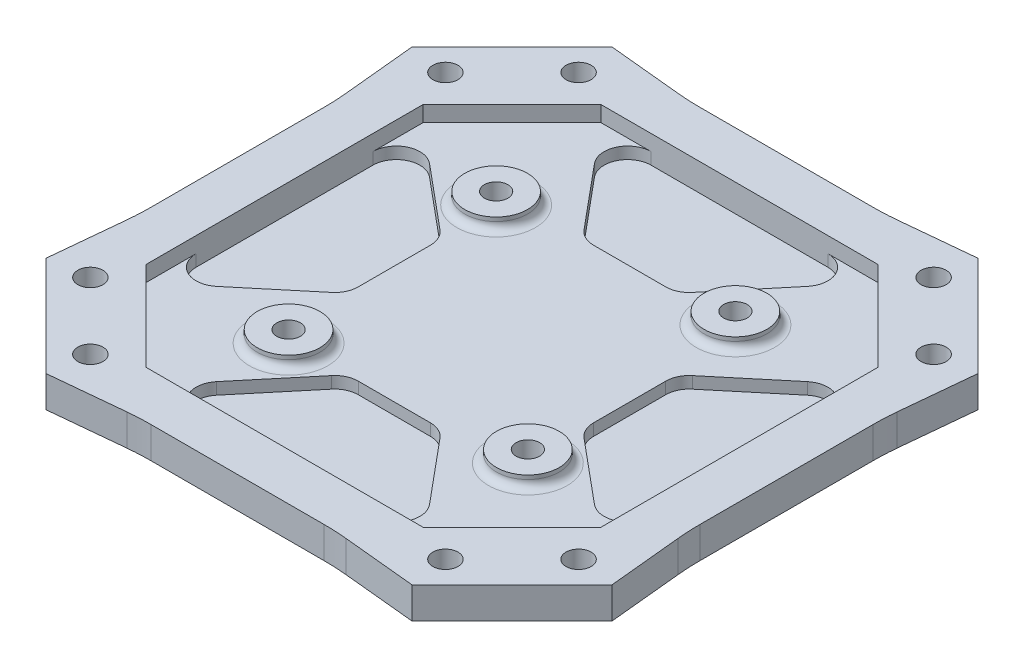
from build123d import *

# Parameters (mm, degrees)
SKETCH2_R           = 1.6
BOSS_EXTRUDE1_DEPTH = 4
CUT_EXTRUDE1_DEPTH  = 2
CUT_EXTRUDE2_DEPTH  = 1.5
SKETCH5_R           = 1.5
CUT_EXTRUDE3_DEPTH  = 52.039200621
BOSS_EXTRUDE2_START = 1.5
SKETCH6_R           = 4
SKETCH6_R_2         = 1.5
BOSS_EXTRUDE2_DEPTH = 1.5
CIRPATTERN1_COUNT   = 4
FILLET1_R           = 1
FILLET2_R           = 30


with BuildPart() as part:
    # Sketch2 → Boss-Extrude1 (new body)
    with BuildSketch(Plane(origin=(0, 0, 0), x_dir=(1, 0, 0), z_dir=(0, 1, 0))):
        Polygon((-12.5, 35), (12.5, 35), (23.334523779, 36.062445841), (36.062445841, 23.334523779), (35, 12.5), (35, -12.5), (36.062445841, -23.334523779), (23.334523779, -36.062445841), (12.5, -35), (-12.5, -35), (-23.334523779, -36.062445841), (-36.062445841, -23.334523779), (-35, -12.5), (-35, 12.5), (-36.062445841, 23.334523779), (-23.334523779, 36.062445841), align=None)
        with Locations(Location((22.627416998, 31.112698372, 0), (0, 0, 270))):
            Circle(SKETCH2_R, mode=Mode.SUBTRACT)
        with Locations(Location((31.112698372, 22.627416998, 0), (0, 0, 270))):
            Circle(SKETCH2_R, mode=Mode.SUBTRACT)
        with Locations(Location((22.627416998, -31.112698372, 0), (0, 0, 270))):
            Circle(SKETCH2_R, mode=Mode.SUBTRACT)
        with Locations(Location((31.112698372, -22.627416998, 0), (0, 0, 270))):
            Circle(SKETCH2_R, mode=Mode.SUBTRACT)
        with Locations(Location((-31.112698372, -22.627416998, 0), (0, 0, 270))):
            Circle(SKETCH2_R, mode=Mode.SUBTRACT)
        with Locations(Location((-22.627416998, -31.112698372, 0), (0, 0, 270))):
            Circle(SKETCH2_R, mode=Mode.SUBTRACT)
        with Locations(Location((-22.627416998, 31.112698372, 0), (0, 0, 270))):
            Circle(SKETCH2_R, mode=Mode.SUBTRACT)
        with Locations(Location((-31.112698372, 22.627416998, 0), (0, 0, 270))):
            Circle(SKETCH2_R, mode=Mode.SUBTRACT)
    extrude(amount=BOSS_EXTRUDE1_DEPTH)

    # Sketch3 → Cut-Extrude1 (cut)
    with BuildSketch(Plane(origin=(0, 4, 0), x_dir=(1, 0, 0), z_dir=(0, 1, 0))):
        Polygon((-17.669047558, 29), (17.669047558, 29), (29, 17.669047558), (29, -17.669047558), (17.669047558, -29), (-17.669047558, -29), (-29, -17.669047558), (-29, 17.669047558), align=None)
    extrude(amount=-CUT_EXTRUDE1_DEPTH, mode=Mode.SUBTRACT)

    # Sketch4 → Cut-Extrude2 (cut)
    with BuildSketch(Plane(origin=(0, 2, 0), x_dir=(1, 0, 0), z_dir=(0, 1, 0))):
        with BuildLine():
            Line((-29, 11.263085893), (-29, -11.263085893))
            ThreePointArc((-29, -11.263085893), (-27.272329864, -13.979918004), (-24.079215521, -13.567556979))
            Line((-24.079215521, -13.567556979), (-16.079215521, -6.899529803))
            ThreePointArc((-16.079215521, -6.899529803), (-15.283167889, -5.867388581), (-15, -4.595058717))
            Line((-15, -4.595058717), (-15, 4.595058717))
            ThreePointArc((-15, 4.595058717), (-15.283167889, 5.867388581), (-16.079215521, 6.899529803))
            Line((-16.079215521, 6.899529803), (-24.079215521, 13.567556979))
            ThreePointArc((-24.079215521, 13.567556979), (-27.272329864, 13.979918004), (-29, 11.263085893))
        make_face()
        with BuildLine():
            Line((11.263085893, 29), (-11.263085893, 29))
            ThreePointArc((-11.263085893, 29), (-13.979918004, 27.272329864), (-13.567556979, 24.079215521))
            Line((-13.567556979, 24.079215521), (-6.899529803, 16.079215521))
            ThreePointArc((-6.899529803, 16.079215521), (-5.867388581, 15.283167889), (-4.595058717, 15))
            Line((-4.595058717, 15), (4.595058717, 15))
            ThreePointArc((4.595058717, 15), (5.867388581, 15.283167889), (6.899529803, 16.079215521))
            Line((6.899529803, 16.079215521), (13.567556979, 24.079215521))
            ThreePointArc((13.567556979, 24.079215521), (13.979918004, 27.272329864), (11.263085893, 29))
        make_face()
        with BuildLine():
            Line((29, -11.263085893), (29, 11.263085893))
            ThreePointArc((29, 11.263085893), (27.272329864, 13.979918004), (24.079215521, 13.567556979))
            Line((24.079215521, 13.567556979), (16.079215521, 6.899529803))
            ThreePointArc((16.079215521, 6.899529803), (15.283167889, 5.867388581), (15, 4.595058717))
            Line((15, 4.595058717), (15, -4.595058717))
            ThreePointArc((15, -4.595058717), (15.283167889, -5.867388581), (16.079215521, -6.899529803))
            Line((16.079215521, -6.899529803), (24.079215521, -13.567556979))
            ThreePointArc((24.079215521, -13.567556979), (27.272329864, -13.979918004), (29, -11.263085893))
        make_face()
        with BuildLine():
            Line((-11.263085893, -29), (11.263085893, -29))
            ThreePointArc((11.263085893, -29), (13.979918004, -27.272329864), (13.567556979, -24.079215521))
            Line((13.567556979, -24.079215521), (6.899529803, -16.079215521))
            ThreePointArc((6.899529803, -16.079215521), (5.867388581, -15.283167889), (4.595058717, -15))
            Line((4.595058717, -15), (-4.595058717, -15))
            ThreePointArc((-4.595058717, -15), (-5.867388581, -15.283167889), (-6.899529803, -16.079215521))
            Line((-6.899529803, -16.079215521), (-13.567556979, -24.079215521))
            ThreePointArc((-13.567556979, -24.079215521), (-13.979918004, -27.272329864), (-11.263085893, -29))
        make_face()
    extrude(amount=-CUT_EXTRUDE2_DEPTH, mode=Mode.SUBTRACT)

    # Sketch5 → Cut-Extrude3 (cut, through all)
    with BuildSketch(Plane(origin=(0, 2, 0), x_dir=(1, 0, 0), z_dir=(0, 1, 0))):
        with Locations(Location((13.22775948, 15.25, 0), (0, 0, 270))):
            Circle(SKETCH5_R)
    cut_extrude3 = extrude(amount=-CUT_EXTRUDE3_DEPTH, mode=Mode.SUBTRACT)

    # Sketch6 → Boss-Extrude2 (add)
    with BuildSketch(Plane(origin=(0, 2, 0), x_dir=(1, 0, 0), z_dir=(0, 1, 0)).offset(BOSS_EXTRUDE2_START)):
        with Locations(Location((13.22775948, 15.25, 0), (0, 0, 90))):
            Circle(SKETCH6_R)
        with Locations(Location((13.22775948, 15.25, 0), (0, 0, 270))):
            Circle(SKETCH6_R_2, mode=Mode.SUBTRACT)
    boss_extrude2 = extrude(amount=-BOSS_EXTRUDE2_DEPTH)

    # CirPattern1: Cut-Extrude3, Boss-Extrude2 ×4 about axis
    cirpattern1_axis = Axis((0, 0, 0), (0, 1, 0))
    add([cut_extrude3.rotate(cirpattern1_axis, i * 360 / CIRPATTERN1_COUNT) for i in range(1, CIRPATTERN1_COUNT)], mode=Mode.SUBTRACT)
    add([boss_extrude2.rotate(cirpattern1_axis, i * 360 / CIRPATTERN1_COUNT) for i in range(1, CIRPATTERN1_COUNT)])

    # Fillet1
    fillet1_edges = [part.edges().sort_by_distance(p)[0] for p in [
        (13.22775948, 2, -11.25),
        (-11.25, 2, -13.22775948),
        (-13.22775948, 2, 11.25),
        (11.25, 2, 13.22775948),
    ]]
    fillet(fillet1_edges, radius=FILLET1_R)

    # Fillet2
    # the kernel refuses this fillet: 30 mm, written as the material it adds along each edge
    with BuildSketch(Plane(origin=(-12.5, 0, -35), x_dir=(1, 0, 0), z_dir=(0, 1, 0)), Plane(origin=(-12.5, 0, 35), x_dir=(-0.9952264052892463, 0, 0.09759304388656388), z_dir=(0, 1, 0)), Plane(origin=(-35, 0, 12.5), x_dir=(0, 0, -1), z_dir=(0, 1, 0)), Plane(origin=(-35, 0, -12.5), x_dir=(-0.09759304388655968, 0, -0.9952264052892468), z_dir=(0, 1, 0))) as fillet2_piece_1:
        with BuildLine():
            CenterArc((FILLET2_R * 0.0489132680018, FILLET2_R), FILLET2_R, 264.399415997, 5.600584003)
            Line((-FILLET2_R * 0.0486797758844, FILLET2_R * 0.00477359471072), (0, 0))
            Line((0, 0), (FILLET2_R * 0.0489132680018, 0))
        make_face()
    extrude(amount=4)
    with BuildSketch(Plane(origin=(12.5, 0, -35), x_dir=(-1, 0, 0), z_dir=(0, 1, 0)), Plane(origin=(35, 0, -12.5), x_dir=(0.09759304388620155, 0, -0.9952264052892819), z_dir=(0, 1, 0)), Plane(origin=(35, 0, 12.5), x_dir=(0, 0, -1), z_dir=(0, 1, 0)), Plane(origin=(12.5, 0, 35), x_dir=(0.9952264052892817, 0, 0.09759304388620309), z_dir=(0, 1, 0))) as fillet2_piece_2:
        with BuildLine():
            CenterArc((FILLET2_R * 0.048913268002, -FILLET2_R), FILLET2_R, 90, 5.600584003)
            Line((-FILLET2_R * 0.0486797758846, -FILLET2_R * 0.00477359471075), (0, 0))
            Line((0, 0), (FILLET2_R * 0.048913268002, 0))
        make_face()
    extrude(amount=4)


solid = part.part
